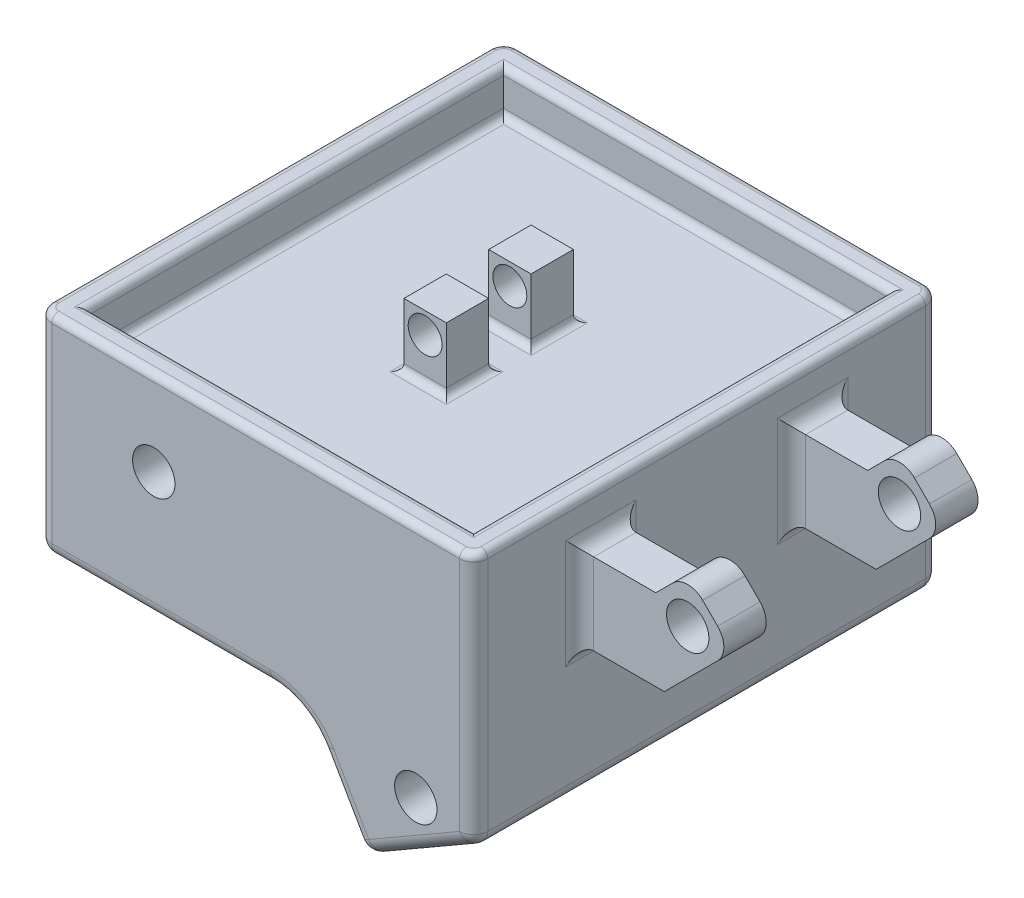
from build123d import *

# Parameters (mm, degrees)
SKETCH2_W           = 139.192
SKETCH2_H           = 101.6
SKETCH2_R           = 12.7
BOSS_EXTRUDE1_DEPTH = 279.4
SKETCH4_W           = 261.402401422
SKETCH4_H           = 279.4
SKETCH4_W_2         = 230.922401422
SKETCH4_H_2         = 248.92
BOSS_EXTRUDE2_DEPTH = 25.4
BOSS_EXTRUDE3_START = -63.5
SKETCH5_R           = 12.7
BOSS_EXTRUDE3_DEPTH = 25.4
SKETCH6_W           = 25.4
SKETCH6_H           = 25.4
BOSS_EXTRUDE4_DEPTH = 38.1
SKETCH7_R           = 10.16
CUT_EXTRUDE1_DEPTH  = 76.2
SCALE1_SCALE        = 3
FILLET1_R           = 12.7
FILLET2_R           = 25.4
FILLET3_R           = 25.4
FILLET5_R           = 25.4


with BuildPart() as part:
    # Sketch2 → Boss-Extrude1 (new body)
    # profile 1 of 3: a face of its own
    with BuildSketch(Plane.XY):
        with Locations((69.596, 50.8)):
            Rectangle(SKETCH2_W, SKETCH2_H)
        with Locations((69.596, 76.2)):
            Circle(SKETCH2_R, mode=Mode.SUBTRACT)
    # profile 2 of 3: a face of its own
    with BuildSketch(Plane.XY):
        with BuildLine():
            Line((139.192, 101.6), (139.192, 0))
            ThreePointArc((139.192, 0), (156.985511322, -4.767756989), (170.011265654, -17.793511322))
            Line((170.011265654, -17.793511322), (236.002401422, 20.306488678))
            Line((236.002401422, 20.306488678), (261.402401422, -23.687601834))
            Line((261.402401422, -23.687601834), (261.402401422, 101.6))
            Line((261.402401422, 101.6), (139.192, 101.6))
        make_face()
    # profile 3 of 3: a face of its own
    with BuildSketch(Plane.XY):
        Polygon((195.411265654, -61.787601834), (170.011265654, -17.793511322), (236.002401422, 20.306488678), (261.402401422, -23.687601834), align=None)
        with Locations((226.705356166, -14.390556578)):
            Circle(SKETCH2_R, mode=Mode.SUBTRACT)
    extrude(amount=BOSS_EXTRUDE1_DEPTH)

    # Sketch4 → Boss-Extrude2 (add)
    with BuildSketch(Plane(origin=(0, 101.6, 0), x_dir=(1, 0, 0), z_dir=(0, 1, 0))):
        with Locations((130.701200711, -139.7)):
            Rectangle(SKETCH4_W, SKETCH4_H)
        with Locations((130.701200711, -139.7)):
            Rectangle(SKETCH4_W_2, SKETCH4_H_2, mode=Mode.SUBTRACT)
    extrude(amount=BOSS_EXTRUDE2_DEPTH)

    # Sketch5 → Boss-Extrude3 (add)
    with BuildSketch(Plane.XY.offset(279.4).offset(BOSS_EXTRUDE3_START)):
        with BuildLine():
            Line((261.402401422, 51.656199083), (312.202401422, 51.656199083))
            Line((312.202401422, 51.656199083), (344.194983673, 83.648781334))
            ThreePointArc((344.194983673, 83.648781334), (347.914727552, 92.629037455), (344.194983673, 101.609293576))
            Line((344.194983673, 101.609293576), (335.214727552, 110.589549697))
            ThreePointArc((335.214727552, 110.589549697), (326.234471431, 114.309293576), (317.254215309, 110.589549697))
            Line((317.254215309, 110.589549697), (307.122401422, 100.45773581))
            Line((307.122401422, 100.45773581), (261.402401422, 100.45773581))
            Line((261.402401422, 100.45773581), (261.402401422, 51.656199083))
        make_face()
        with Locations((326.234471431, 92.629037455)):
            Circle(SKETCH5_R, mode=Mode.SUBTRACT)
    boss_extrude3 = extrude(amount=-BOSS_EXTRUDE3_DEPTH)

    # Mirror1: Boss-Extrude3 across plane
    add(boss_extrude3.mirror(Plane.XY.offset(139.7)))

    # Sketch6 → Boss-Extrude4 (add)
    with BuildSketch(Plane(origin=(0, 101.6, 0), x_dir=(1, 0, 0), z_dir=(0, 1, 0))):
        with Locations((130.701200711, -114.3)):
            Rectangle(SKETCH6_W, SKETCH6_H)
        with Locations((130.701200711, -165.1)):
            Rectangle(SKETCH6_W, SKETCH6_H)
    extrude(amount=BOSS_EXTRUDE4_DEPTH)

    # Sketch7 → Cut-Extrude1 (cut)
    with BuildSketch(Plane.XY.offset(177.8)):
        with Locations((130.701200711, 127)):
            Circle(SKETCH7_R)
    extrude(amount=-CUT_EXTRUDE1_DEPTH, mode=Mode.SUBTRACT)


with BuildPart() as part_1:
    # Scale1: scaled about (143.551633531, 45.911568098, 139.7)
    add(part.part.scale(SCALE1_SCALE).moved(Location((-287.103267062, -91.823136196, -279.4))))

    # Fillet1
    fillet1_edges = [part_1.edges().sort_by_distance(p)[0] for p in [
        (66.900335071, 212.976863804, 63.5),
        (105.000335071, 212.976863804, 101.6),
        (143.100335071, 212.976863804, 63.5),
        (105.000335071, 212.976863804, 25.4),
        (66.900335071, 212.976863804, 215.9),
        (105.000335071, 212.976863804, 254),
        (143.100335071, 212.976863804, 215.9),
        (105.000335071, 212.976863804, 177.8),
        (451.383937205, 289.176863804, 139.7),
        (105.000335071, 289.176863804, 513.08),
        (-241.383267062, 212.976863804, 139.7),
        (105.000335071, 212.976863804, -233.68),
        (-241.383267062, 289.176863804, 139.7),
        (105.000335071, 289.176863804, -233.68),
        (497.103937205, 289.176863804, 139.7),
        (105.000335071, 289.176863804, -279.4),
        (-287.103267062, 289.176863804, 139.7),
        (105.000335071, 289.176863804, 558.8),
        (451.383937205, 212.976863804, 139.7),
        (105.000335071, 212.976863804, 513.08),
    ]]
    fillet(fillet1_edges, radius=FILLET1_R)

    # Fillet2
    fillet2_edges = [part_1.edges().sort_by_distance(p)[0] for p in [
        (-287.103267062, -91.823136196, 139.7),
        (497.103937205, -162.885941697, 139.7),
        (299.1305299, -277.185941697, 139.7),
    ]]
    fillet(fillet2_edges, radius=FILLET2_R)

    # Fillet3
    # the kernel refuses this fillet: 25.4 mm, written as the material it takes off along each edge
    with BuildSketch(Plane(origin=(-261.703267062, 289.176863804, -254), x_dir=(0, 0, -1), z_dir=(1, 0, 0))) as fillet3_piece_1:
        with BuildLine():
            CenterArc((12.7, -12.7), 12.7, 0, 90)
            Line((25.4, -12.7), (25.4, 0))
            Line((25.4, 0), (12.7, 0))
        make_face()
    revolve(axis=Axis((-261.703267062, 289.176863804, -254), (0, 1, 0)), revolution_arc=90, mode=Mode.SUBTRACT)
    with BuildSketch(Plane(origin=(471.703937205, 289.176863804, -254), x_dir=(1, 0, 0), z_dir=(0, 0, 1))) as fillet3_piece_2:
        with BuildLine():
            CenterArc((12.7, -12.7), 12.7, 0, 90)
            Line((25.4, -12.7), (25.4, 0))
            Line((25.4, 0), (12.7, 0))
        make_face()
    revolve(axis=Axis((471.703937205, 289.176863804, -254), (0, 1, 0)), revolution_arc=90, mode=Mode.SUBTRACT)
    with BuildSketch(Plane(origin=(-261.703267062, 289.176863804, 533.4), x_dir=(-1, 0, 0), z_dir=(0, 0, -1))) as fillet3_piece_3:
        with BuildLine():
            CenterArc((12.7, -12.7), 12.7, 0, 90)
            Line((25.4, -12.7), (25.4, 0))
            Line((25.4, 0), (12.7, 0))
        make_face()
    revolve(axis=Axis((-261.703267062, 289.176863804, 533.4), (0, 1, 0)), revolution_arc=90, mode=Mode.SUBTRACT)
    with BuildSketch(Plane(origin=(471.703937205, 289.176863804, 533.4), x_dir=(0, 0, 1), z_dir=(-1, 0, 0))) as fillet3_piece_4:
        with BuildLine():
            CenterArc((12.7, -12.7), 12.7, 0, 90)
            Line((25.4, -12.7), (25.4, 0))
            Line((25.4, 0), (12.7, 0))
        make_face()
    revolve(axis=Axis((471.703937205, 289.176863804, 533.4), (0, 1, 0)), revolution_arc=90, mode=Mode.SUBTRACT)
    with BuildSketch(Plane(origin=(497.103937205, -148.22124486, 558.8), x_dir=(-1, 0, 0), z_dir=(0, 1, 0)), Plane(origin=(497.103937205, 289.176863804, -279.4), x_dir=(-1, 0, 0), z_dir=(0, -1, 0))) as fillet3_piece_5:
        with BuildLine():
            CenterArc((FILLET3_R, -FILLET3_R), FILLET3_R, 90, 90)
            Line((0, -FILLET3_R), (0, 0))
            Line((0, 0), (FILLET3_R, 0))
        make_face()
    extrude(amount=437.398108664, mode=Mode.SUBTRACT)
    with BuildSketch(Plane(origin=(130.472732938, -198.584204125, -279.4), x_dir=(0, 1, 0), z_dir=(-1, 0, 0))) as fillet3_piece_6:
        with BuildLine():
            CenterArc((106.761067929 + FILLET3_R, -FILLET3_R), FILLET3_R, 90, 90)
            Line((106.761067929, -FILLET3_R), (106.761067929, 0))
            Line((106.761067929, 0), (106.761067929 + FILLET3_R, 0))
        make_face()
    revolve(axis=Axis((130.472732938, -198.584204125, -279.4), (0, 0, -1)), revolution_arc=60, mode=Mode.SUBTRACT)
    with BuildSketch(Plane(origin=(130.472732938, -198.584204125, 558.8), x_dir=(0, 1, 0), z_dir=(-1, 0, 0))) as fillet3_piece_7:
        with BuildLine():
            CenterArc((106.761067929 + FILLET3_R, FILLET3_R), FILLET3_R, 180, 90)
            Line((106.761067929, FILLET3_R), (106.761067929, 0))
            Line((106.761067929, 0), (106.761067929 + FILLET3_R, 0))
        make_face()
    revolve(axis=Axis((130.472732938, -198.584204125, 558.8), (0, 0, -1)), revolution_arc=60, mode=Mode.SUBTRACT)
    with BuildSketch(Plane(origin=(-287.103267062, 289.176863804, -279.4), x_dir=(0, 0, 1), z_dir=(0, -1, 0)), Plane(origin=(-287.103267062, -66.423136196, 558.8), x_dir=(0, 0, -1), z_dir=(0, 1, 0))) as fillet3_piece_8:
        with BuildLine():
            CenterArc((FILLET3_R, -FILLET3_R), FILLET3_R, 90, 90)
            Line((0, -FILLET3_R), (0, 0))
            Line((0, 0), (FILLET3_R, 0))
        make_face()
    extrude(amount=355.6, mode=Mode.SUBTRACT)
    with BuildSketch(Plane(origin=(484.403937205, -170.218290116, -279.4), x_dir=(-0.5000000000000038, 0.8660254037844364, 0), z_dir=(-0.8660254037844365, -0.5000000000000038, 0))) as fillet3_piece_9:
        with BuildLine():
            CenterArc((FILLET3_R, -FILLET3_R), FILLET3_R, 90, 90)
            Line((0, -FILLET3_R), (0, 0))
            Line((0, 0), (FILLET3_R, 0))
        make_face()
    extrude(amount=188.535303163, mode=Mode.SUBTRACT)
    with BuildSketch(Plane(origin=(286.4305299, -255.188896441, -279.4), x_dir=(0.8660254037844366, 0.5000000000000034, 0), z_dir=(-0.5000000000000036, 0.8660254037844367, 0))) as fillet3_piece_10:
        with BuildLine():
            CenterArc((FILLET3_R, -FILLET3_R), FILLET3_R, 90, 90)
            Line((0, -FILLET3_R), (0, 0))
            Line((0, 0), (FILLET3_R, 0))
        make_face()
    extrude(amount=127, mode=Mode.SUBTRACT)
    with BuildSketch(Plane(origin=(130.472732938, -91.823136196, -279.4), x_dir=(0, 1, 0), z_dir=(-1, 0, 0))) as fillet3_piece_11:
        with BuildLine():
            CenterArc((FILLET3_R, -FILLET3_R), FILLET3_R, 90, 90)
            Line((0, -FILLET3_R), (0, 0))
            Line((0, 0), (FILLET3_R, 0))
        make_face()
    extrude(amount=392.176, mode=Mode.SUBTRACT)
    with BuildSketch(Plane(origin=(-261.703267062, -66.423136196, -279.4), x_dir=(-1, 0, 0), z_dir=(0, 1, 0))) as fillet3_piece_12:
        with BuildLine():
            CenterArc((25.4 - FILLET3_R, FILLET3_R), FILLET3_R, 270, 90)
            Line((25.4 - FILLET3_R, 0), (25.4, 0))
            Line((25.4, 0), (25.4, FILLET3_R))
        make_face()
    revolve(axis=Axis((-261.703267062, -66.423136196, -279.4), (0, 0, 1)), revolution_arc=90, mode=Mode.SUBTRACT)
    with BuildSketch(Plane(origin=(308.427575156, -242.488896441, -279.4), x_dir=(0.5000000000000039, -0.8660254037844364, 0), z_dir=(0.8660254037844364, 0.5000000000000039, 0))) as fillet3_piece_13:
        with BuildLine():
            CenterArc((25.4 - FILLET3_R, -FILLET3_R), FILLET3_R, 0, 90)
            Line((25.4, -FILLET3_R), (25.4, 0))
            Line((25.4, 0), (25.4 - FILLET3_R, 0))
        make_face()
    revolve(axis=Axis((308.427575156, -242.488896441, -279.4), (0, 0, -1)), revolution_arc=90, mode=Mode.SUBTRACT)
    with BuildSketch(Plane(origin=(471.703937205, -148.22124486, -279.4), x_dir=(1, 0, 0), z_dir=(0, 1, 0))) as fillet3_piece_14:
        with BuildLine():
            CenterArc((25.4 - FILLET3_R, -FILLET3_R), FILLET3_R, 0, 90)
            Line((25.4, -FILLET3_R), (25.4, 0))
            Line((25.4, 0), (25.4 - FILLET3_R, 0))
        make_face()
    revolve(axis=Axis((471.703937205, -148.22124486, -279.4), (0, 0, -1)), revolution_arc=60, mode=Mode.SUBTRACT)
    with BuildSketch(Plane(origin=(484.403937205, -170.218290116, 558.8), x_dir=(-0.5000000000000038, 0.8660254037844364, 0), z_dir=(-0.8660254037844365, -0.5000000000000038, 0))) as fillet3_piece_15:
        with BuildLine():
            CenterArc((FILLET3_R, FILLET3_R), FILLET3_R, 180, 90)
            Line((0, FILLET3_R), (0, 0))
            Line((0, 0), (FILLET3_R, 0))
        make_face()
    extrude(amount=188.535303163, mode=Mode.SUBTRACT)
    with BuildSketch(Plane(origin=(130.472732938, -91.823136196, 558.8), x_dir=(0, 1, 0), z_dir=(-1, 0, 0))) as fillet3_piece_16:
        with BuildLine():
            CenterArc((FILLET3_R, FILLET3_R), FILLET3_R, 180, 90)
            Line((0, FILLET3_R), (0, 0))
            Line((0, 0), (FILLET3_R, 0))
        make_face()
    extrude(amount=392.176, mode=Mode.SUBTRACT)
    with BuildSketch(Plane(origin=(286.4305299, -255.188896441, 558.8), x_dir=(0.8660254037844366, 0.5000000000000034, 0), z_dir=(-0.5000000000000036, 0.8660254037844367, 0))) as fillet3_piece_17:
        with BuildLine():
            CenterArc((FILLET3_R, FILLET3_R), FILLET3_R, 180, 90)
            Line((0, FILLET3_R), (0, 0))
            Line((0, 0), (FILLET3_R, 0))
        make_face()
    extrude(amount=127, mode=Mode.SUBTRACT)
    with BuildSketch(Plane(origin=(-261.703267062, -66.423136196, 558.8), x_dir=(-1, 0, 0), z_dir=(0, 1, 0))) as fillet3_piece_18:
        with BuildLine():
            CenterArc((25.4 - FILLET3_R, -FILLET3_R), FILLET3_R, 0, 90)
            Line((25.4, -FILLET3_R), (25.4, 0))
            Line((25.4, 0), (25.4 - FILLET3_R, 0))
        make_face()
    revolve(axis=Axis((-261.703267062, -66.423136196, 558.8), (0, 0, 1)), revolution_arc=90, mode=Mode.SUBTRACT)
    with BuildSketch(Plane(origin=(308.427575156, -242.488896441, 558.8), x_dir=(0.5000000000000039, -0.8660254037844364, 0), z_dir=(0.8660254037844364, 0.5000000000000039, 0))) as fillet3_piece_19:
        with BuildLine():
            CenterArc((25.4 - FILLET3_R, FILLET3_R), FILLET3_R, 270, 90)
            Line((25.4, FILLET3_R), (25.4, 0))
            Line((25.4, 0), (25.4 - FILLET3_R, 0))
        make_face()
    revolve(axis=Axis((308.427575156, -242.488896441, 558.8), (0, 0, -1)), revolution_arc=90, mode=Mode.SUBTRACT)
    with BuildSketch(Plane(origin=(471.703937205, -148.22124486, 558.8), x_dir=(1, 0, 0), z_dir=(0, 1, 0))) as fillet3_piece_20:
        with BuildLine():
            CenterArc((25.4 - FILLET3_R, FILLET3_R), FILLET3_R, 270, 90)
            Line((25.4, FILLET3_R), (25.4, 0))
            Line((25.4, 0), (25.4 - FILLET3_R, 0))
        make_face()
    revolve(axis=Axis((471.703937205, -148.22124486, 558.8), (0, 0, -1)), revolution_arc=60, mode=Mode.SUBTRACT)

    # Fillet5
    fillet5_edges = [part_1.edges().sort_by_distance(p)[0] for p in [
        (497.103937205, 136.347766143, 292.1),
        (497.103937205, 63.145461053, 330.2),
        (497.103937205, 209.550071233, 330.2),
        (497.103937205, 136.347766143, 368.3),
        (497.103937205, 136.347766143, -12.7),
        (497.103937205, 136.347766143, -88.9),
        (497.103937205, 209.550071233, -50.8),
        (497.103937205, 63.145461053, -50.8),
    ]]
    fillet(fillet5_edges, radius=FILLET5_R)


solid = part_1.part
